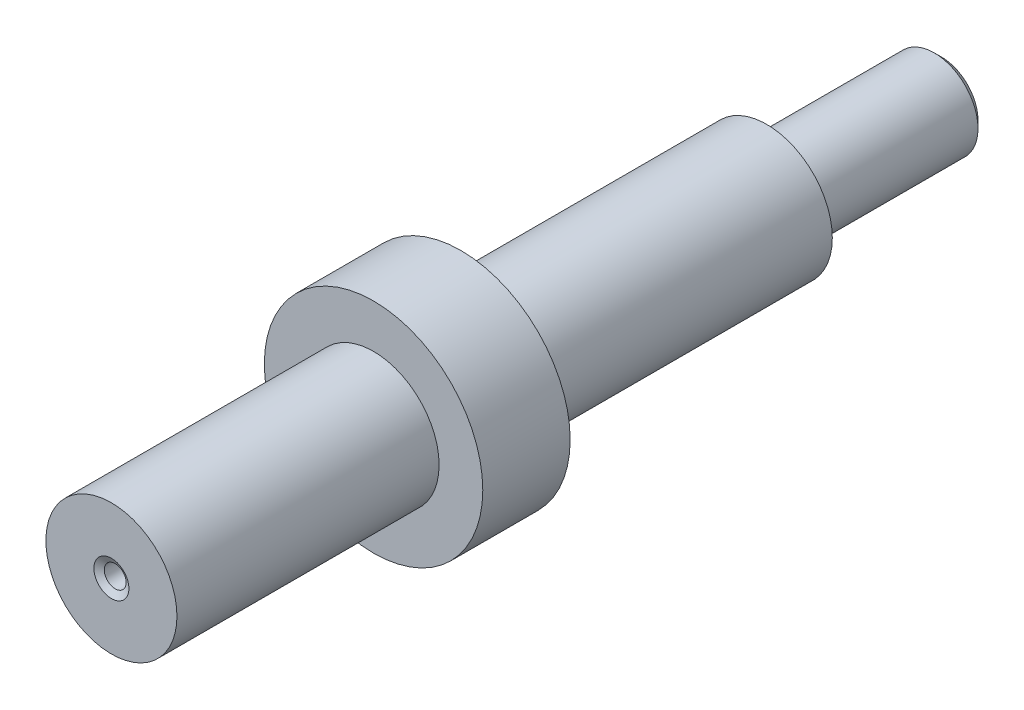
from build123d import *

# Parameters (mm, degrees)
SKETCH1_R                       = 12.5
F_25MM_DIA_DEPTH                = 10
F_15MM_START                    = -10
SKETCH2_R                       = 7.5
F_15MM_DIA_BEARING_END_DEPTH    = 40
F_15MM_START_2                  = 55
SKETCH3_R                       = 7.5
F_15MM_DIA_GEAR_END_DEPTH       = 55
M3X0_5_TAPPED_HOLE1_D           = 2.5
M3X0_5_TAPPED_HOLE1_DEPTH       = 15
M3X0_5_TAPPED_HOLE1_CSINK_D     = 4
M3X0_5_TAPPED_HOLE1_CSINK_ANGLE = 120
M3X0_5_TAPPED_HOLE1_TIP         = 0.751075774
CUT_EXTRUDE1_DEPTH              = 2


# Read off the part's stored shape, not the designer's step: M10x1.5 Machine Threads Stud1
with BuildPart() as part:
    # Sketch1 → 25mm dia (new body)
    with BuildSketch(Plane.XY):
        Circle(SKETCH1_R)
    extrude(amount=F_25MM_DIA_DEPTH)

    # Sketch2 → 15mm dia bearing end (add)
    with BuildSketch(Plane.XY.offset(10).offset(F_15MM_START)):
        Circle(SKETCH2_R)
    extrude(amount=F_15MM_DIA_BEARING_END_DEPTH)

    # Sketch3 → 15mm dia gear end (add)
    with BuildSketch(Plane(origin=(0, 0, 0), x_dir=(-1, 0, 0), z_dir=(0, 0, -1)).offset(F_15MM_START_2)):
        with Locations(Location((0, 0, 0), (0, 0, 180))):
            Circle(SKETCH3_R)
    extrude(amount=-F_15MM_DIA_GEAR_END_DEPTH)

    # M3x0.5 Tapped Hole1
    with Locations(Plane.XY.offset(40)):
        with Locations((0, 0)):
            CounterSinkHole(M3X0_5_TAPPED_HOLE1_D / 2, M3X0_5_TAPPED_HOLE1_CSINK_D / 2, depth=M3X0_5_TAPPED_HOLE1_DEPTH, counter_sink_angle=M3X0_5_TAPPED_HOLE1_CSINK_ANGLE)
            with Locations((0, 0, -(M3X0_5_TAPPED_HOLE1_DEPTH + M3X0_5_TAPPED_HOLE1_TIP / 2))):  # 118° drill point
                Cone(0, M3X0_5_TAPPED_HOLE1_D / 2, M3X0_5_TAPPED_HOLE1_TIP, mode=Mode.SUBTRACT)

    # M10x1.5 Machine Threads Stud1 outline → M10x1.5 Machine Threads Stud1 (revolve, cut)
    with BuildSketch(Plane.XZ):
        Polygon((4.172, -55), (7.5, -55), (7.5, -35), (5, -35), (5, -54.172), align=None)
    revolve(axis=Axis((0, 0, 0), (0, 0, 1)), mode=Mode.SUBTRACT)

    # Sketch15 → Cut-Extrude1 (cut)
    with BuildSketch(Plane.ZY.offset(7.5)):
        with BuildLine():
            Line((-35, 2), (-2, 2))
            ThreePointArc((-2, 2), (0, 0), (-2, -2))
            Line((-2, -2), (-35, -2))
            Line((-35, -2), (-35, 2))
        make_face()
    extrude(amount=-CUT_EXTRUDE1_DEPTH, mode=Mode.SUBTRACT)


solid = part.part
